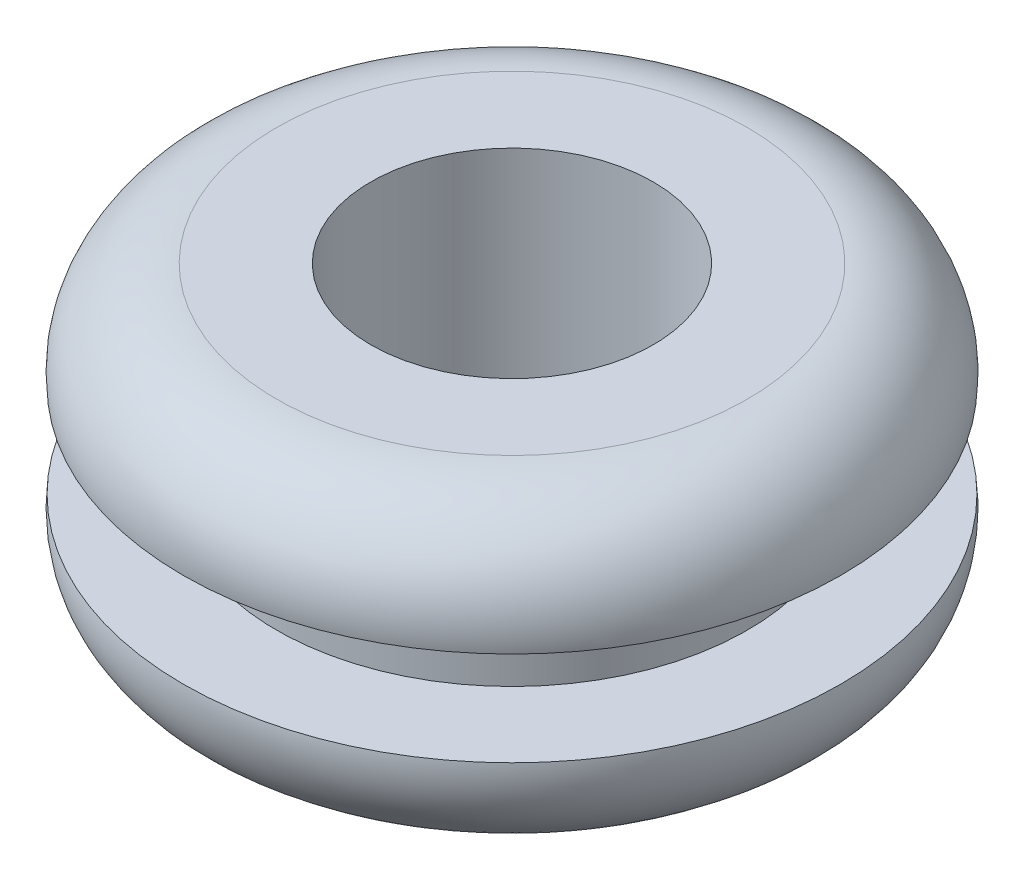
from build123d import *


with BuildPart() as part:
    # Sketch2 → Revolve1 (revolve)
    with BuildSketch(Plane(origin=(0, 0, 0), x_dir=(0, 0, -1), z_dir=(1, 0, 0))):
        with BuildLine():
            Line((-4.7625, -5.159375), (-4.7625, 5.159375))
            Line((-4.7625, 5.159375), (-7.9375, 5.159375))
            ThreePointArc((-7.9375, 5.159375), (-10.31875, 4.084440103), (-11.087597655, 1.5875))
            Line((-11.087597655, 1.5875), (-7.9375, 1.5875))
            Line((-7.9375, 1.5875), (-7.9375, -1.5875))
            Line((-7.9375, -1.5875), (-11.087597655, -1.5875))
            ThreePointArc((-11.087597655, -1.5875), (-10.31875, -4.084440103), (-7.9375, -5.159375))
            Line((-7.9375, -5.159375), (-4.7625, -5.159375))
        make_face()
    revolve(axis=Axis((0, -5.159375, 0), (0, 1, 0)))


solid = part.part
